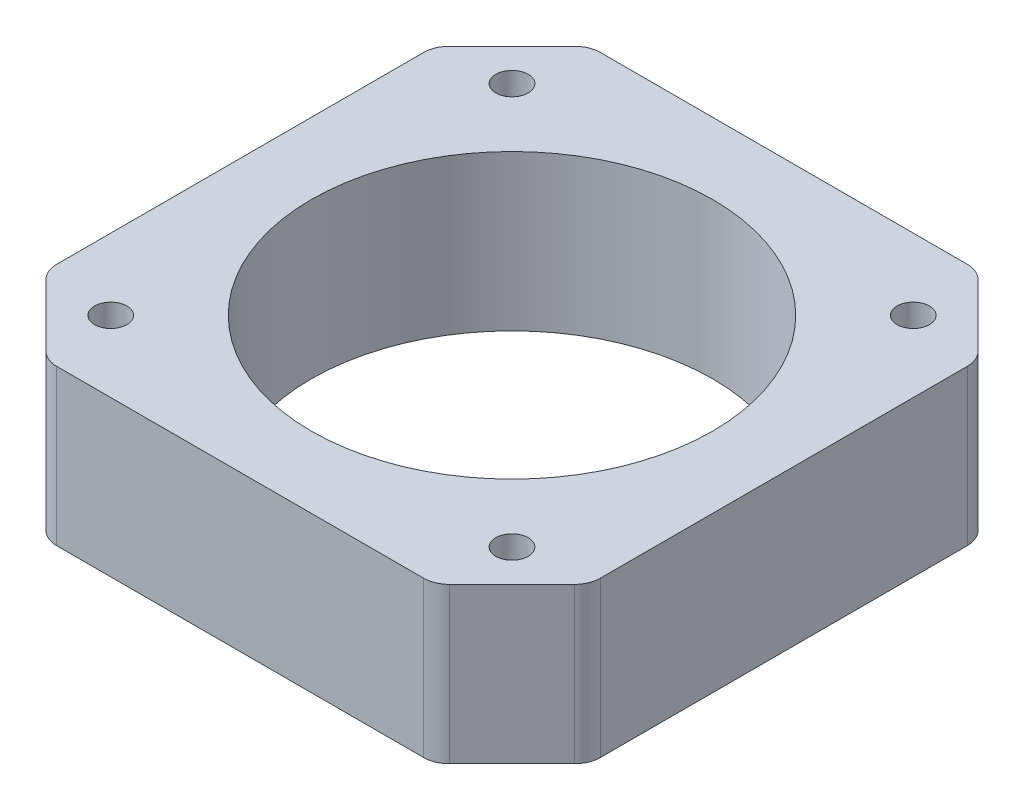
from build123d import *

# Parameters (mm, degrees)
SKETCH1_R           = 15.5
SKETCH1_R_2         = 1.25
BOSS_EXTRUDE2_DEPTH = 12
FILLET1_R           = 2


with BuildPart() as part:
    # Sketch1 → Boss-Extrude2 (new body)
    with BuildSketch(Plane(origin=(0, 0, 0), x_dir=(1, 0, 0), z_dir=(0, 1, 0))):
        Polygon((-15, 21.000989792), (-21, 15.000989792), (-21, -15.000989792), (-15, -21.000989792), (15, -21.000989792), (21, -15.000989792), (21, 15.000989792), (15, 21.000989792), align=None)
        Circle(SKETCH1_R, mode=Mode.SUBTRACT)
        with Locations((-15.5, 15.5)):
            Circle(SKETCH1_R_2, mode=Mode.SUBTRACT)
        with Locations((15.5, 15.5)):
            Circle(SKETCH1_R_2, mode=Mode.SUBTRACT)
        with Locations((-15.5, -15.5)):
            Circle(SKETCH1_R_2, mode=Mode.SUBTRACT)
        with Locations((15.5, -15.5)):
            Circle(SKETCH1_R_2, mode=Mode.SUBTRACT)
    extrude(amount=BOSS_EXTRUDE2_DEPTH)

    # Fillet1
    fillet1_edges = [part.edges().sort_by_distance(p)[0] for p in [
        (15, 6, -21.000989792),
        (21, 6, -15.000989792),
        (21, 6, 15.000989792),
        (15, 6, 21.000989792),
        (-15, 6, 21.000989792),
        (-21, 6, 15.000989792),
        (-15, 6, -21.000989792),
        (-21, 6, -15.000989792),
    ]]
    fillet(fillet1_edges, radius=FILLET1_R)


solid = part.part
